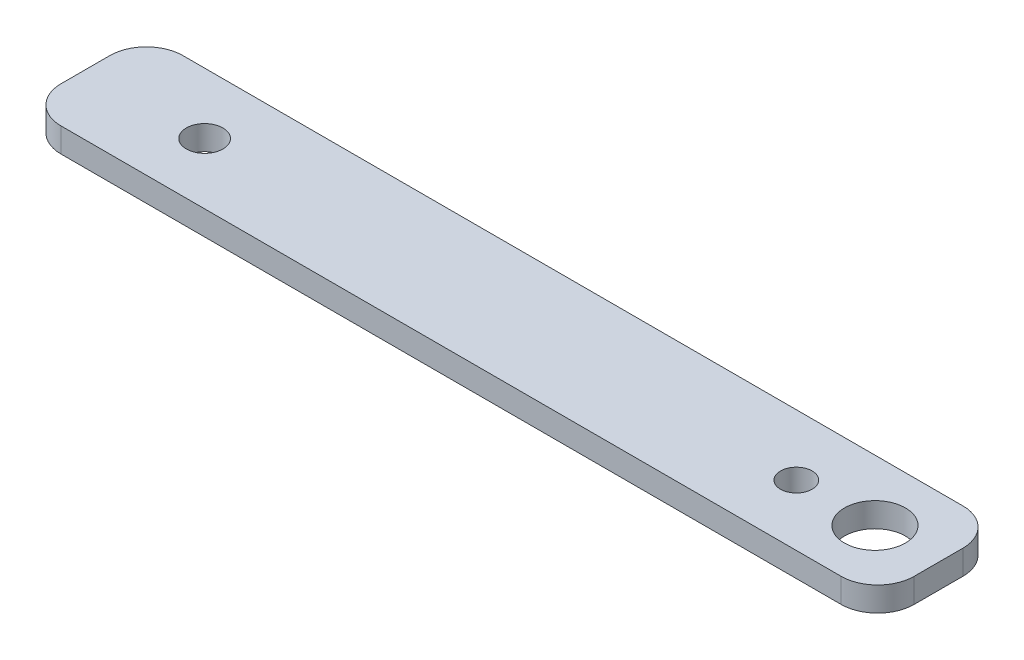
from build123d import *

# Parameters (mm, degrees)
SKETCH1_W             = 70
SKETCH1_H             = 10
BOSS_EXTRUDE1_DEPTH   = 2
F_5_0MM_DOWEL_HOLE1_D = 5
F_3_0MM_DOWEL_HOLE1_D = 3
SKETCH2_R             = 1.3
CUT_EXTRUDE1_DEPTH    = 3
FILLET1_R             = 3


with BuildPart() as part:
    # Sketch1 → Boss-Extrude1 (new body)
    with BuildSketch(Plane(origin=(0, 0, 0), x_dir=(1, 0, 0), z_dir=(0, 1, 0))):
        Rectangle(SKETCH1_W, SKETCH1_H)
    extrude(amount=BOSS_EXTRUDE1_DEPTH)

    # Ø5.0mm Dowel Hole1 (through all)
    with Locations(Plane(origin=(0, 2, 0), x_dir=(1, 0, 0), z_dir=(0, 1, 0))):
        with Locations((29.779724949, 0)):
            Hole(F_5_0MM_DOWEL_HOLE1_D / 2)

    # Ø3.0mm Dowel Hole1 (through all)
    with Locations(Plane(origin=(0, 2, 0), x_dir=(1, 0, 0), z_dir=(0, 1, 0))):
        with Locations((-25.220275051, 0)):
            Hole(F_3_0MM_DOWEL_HOLE1_D / 2)

    # Sketch2 → Cut-Extrude1 (cut)
    with BuildSketch(Plane(origin=(0, 2, 0), x_dir=(1, 0, 0), z_dir=(0, 1, 0))):
        with Locations((23.329724949, 0)):
            Circle(SKETCH2_R)
    extrude(amount=-CUT_EXTRUDE1_DEPTH, mode=Mode.SUBTRACT)

    # Fillet1
    fillet1_edges = [part.edges().sort_by_distance(p)[0] for p in [
        (35, 1, 5),
        (35, 1, -5),
        (-35, 1, -5),
        (-35, 1, 5),
    ]]
    fillet(fillet1_edges, radius=FILLET1_R)


solid = part.part
